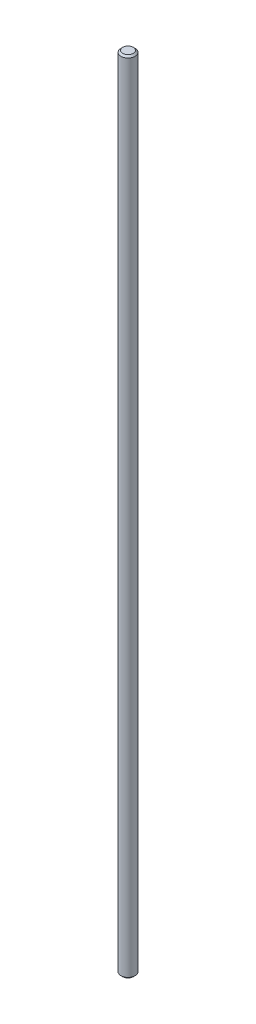
from build123d import *

# Parameters (mm, degrees)
SKETCH1_R           = 4
BOSS_EXTRUDE1_DEPTH = 455
CHAMFER1_SIZE       = 1


with BuildPart() as part:
    # Sketch1 → Boss-Extrude1 (new body)
    with BuildSketch(Plane(origin=(0, 0, 0), x_dir=(1, 0, 0), z_dir=(0, 1, 0))):
        Circle(SKETCH1_R)
    extrude(amount=BOSS_EXTRUDE1_DEPTH)

    # Chamfer1
    chamfer1_edges = [part.edges().sort_by_distance(p)[0] for p in [
        (-4, 455, 0),
        (-4, 0, 0),
    ]]
    chamfer(chamfer1_edges, length=CHAMFER1_SIZE)


solid = part.part
